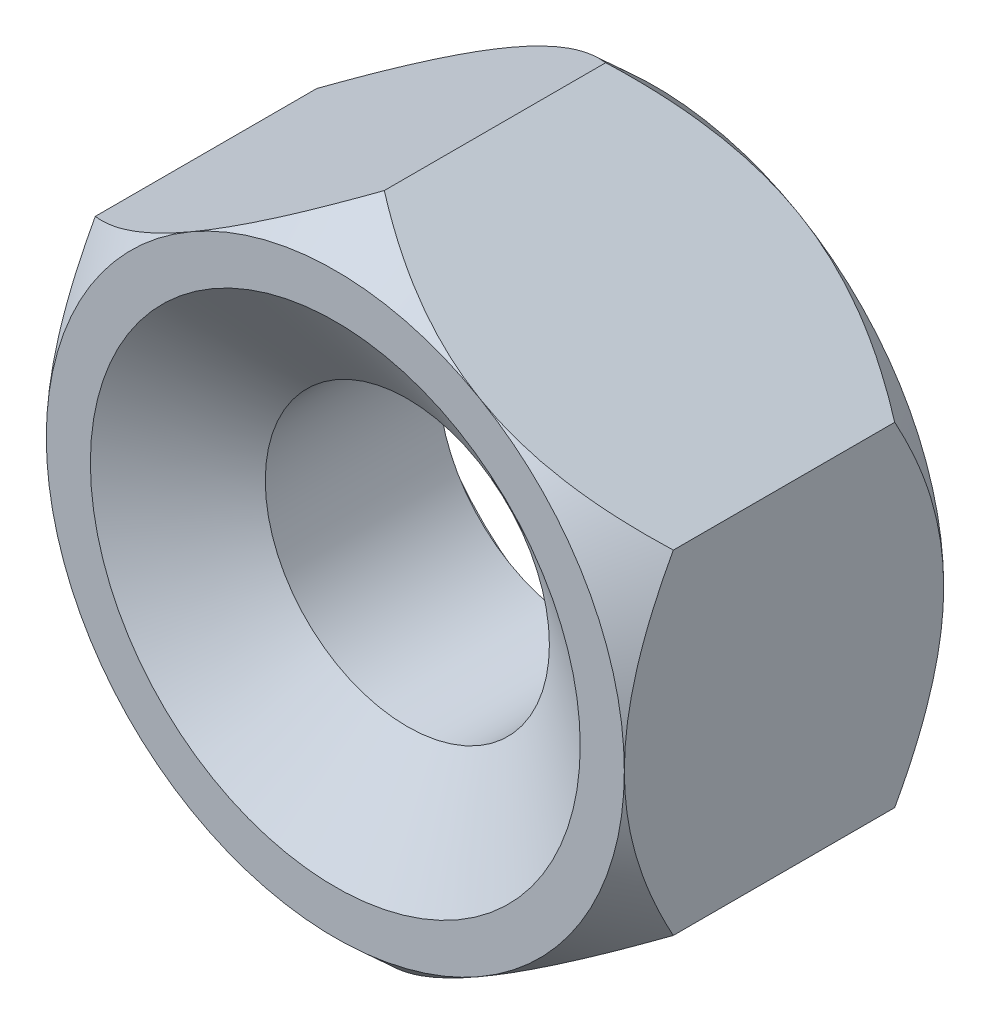
from build123d import *

# Parameters (mm, degrees)
THREADSCHEMATIC_START     = -4.1402
THREADSCHEMATIC_OUTLINE_R = 1.8415
THREADSCHEMATIC_DEPTH     = 4.1402


# Read off the part's stored shape, not the designer's step: ThreadSchematic
with BuildPart() as part:
    # ThreadSchematic outline → ThreadSchematic (new body)
    with BuildSketch(Plane.XY.offset(THREADSCHEMATIC_START)):
        Polygon((3.7465, 2.163042784), (0, 4.326085567), (-3.7465, 2.163042784), (-3.7465, -2.163042784), (0, -4.326085567), (3.7465, -2.163042784), align=None)
        Circle(THREADSCHEMATIC_OUTLINE_R, mode=Mode.SUBTRACT)
    extrude(amount=THREADSCHEMATIC_DEPTH)

    # Sketch3 → Double-Chamfer (revolve, cut)
    with BuildSketch(Plane(origin=(0, 0, 0), x_dir=(0, 0, -1), z_dir=(1, 0, 0))):
        Polygon((4.1402, 3.7465), (3.5052, 4.326085567), (3.5052, 17.026085567), (16.8402, 17.026085567), (16.8402, 3.7465), align=None)
        Polygon((0.635, 17.026085567), (-12.7, 17.026085567), (-12.7, 3.7465), (0, 3.7465), (0.635, 4.326085567), align=None)
    revolve(axis=Axis((0, 0, 0), (0, 0, -1)), mode=Mode.SUBTRACT)

    # EndChamferSke → EndChamfer (revolve, cut)
    with BuildSketch(Plane(origin=(0, 0, 0), x_dir=(0, 0, -1), z_dir=(1, 0, 0)), mode=Mode.PRIVATE) as endchamfer_sk:
        Polygon((4.1148, 3.175), (3.087700573, 1.70815), (4.1656, 1.70815), (4.1656, 3.175), align=None)
        Polygon((-0.0508, 3.175), (0, 3.175), (1.027099427, 1.70815), (-0.0508, 1.70815), align=None)
    revolve(endchamfer_sk.sketch.rotate(Axis((0, 0, -25.037505729), (0, 0, -1)), 90), axis=Axis((0, 0, -25.037505729), (0, 0, -1)), mode=Mode.SUBTRACT)


solid = part.part
